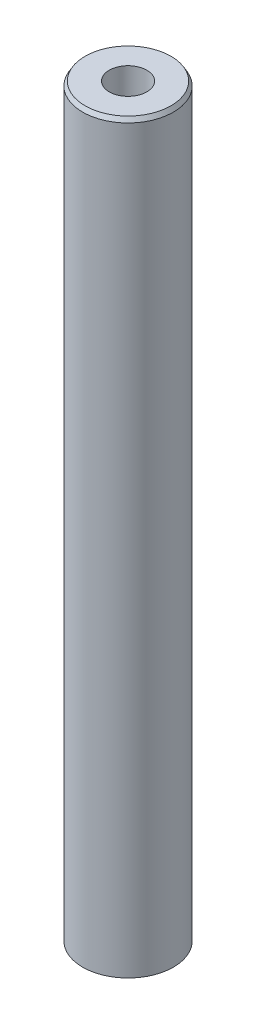
from build123d import *
from OCP.BRepFilletAPI import BRepFilletAPI_MakeChamfer

# Parameters (mm, degrees)
SKETCH1_R           = 10
BOSS_EXTRUDE1_DEPTH = 164.607561644
SKETCH2_R           = 4.14096782
CUT_EXTRUDE1_DEPTH  = 166.213950229
CHAMFER1_SIZE       = 0.938037652
CHAMFER1_SIZE2      = 0.541576291


with BuildPart() as part:
    # Sketch1 → Boss-Extrude1 (new body)
    with BuildSketch(Plane(origin=(0, 0, 0), x_dir=(1, 0, 0), z_dir=(0, 1, 0))):
        Circle(SKETCH1_R)
    extrude(amount=BOSS_EXTRUDE1_DEPTH)

    # Sketch2 → Cut-Extrude1 (cut, through all)
    with BuildSketch(Plane(origin=(0, 0, 0), x_dir=(1, 0, 0), z_dir=(0, 1, 0))):
        Circle(SKETCH2_R)
    extrude(amount=CUT_EXTRUDE1_DEPTH, mode=Mode.SUBTRACT)

    # Chamfer1: one chamfer whose edges measure the first distance from different faces: ONE call of the kernel's chamfer builder (chamfer() names one face for all edges)
    chamfer1_edges_1 = [part.edges().sort_by_distance(p)[0] for p in [
        (-10, 164.607561644, 0),
    ]]
    chamfer1_side_1 = [part.faces().sort_by_distance(p)[0] for p in [
        (-10, 82.303780822, 0),
    ]]
    chamfer1_edges_2 = [part.edges().sort_by_distance(p)[0] for p in [
        (-10, 0, 0),
    ]]
    chamfer1_side_2 = [part.faces().sort_by_distance(p)[0] for p in [
        (-9.717157288, 0, 0),
    ]]
    chamfer1 = BRepFilletAPI_MakeChamfer(part.part.solid().wrapped)
    for e in chamfer1_edges_1:
        chamfer1.Add(CHAMFER1_SIZE, CHAMFER1_SIZE2, e.wrapped, chamfer1_side_1[0].wrapped)  # the first distance lies on this face
    for e in chamfer1_edges_2:
        chamfer1.Add(CHAMFER1_SIZE, CHAMFER1_SIZE2, e.wrapped, chamfer1_side_2[0].wrapped)  # the first distance lies on this face
    add(Compound.cast(chamfer1.Shape()), mode=Mode.REPLACE)


solid = part.part
